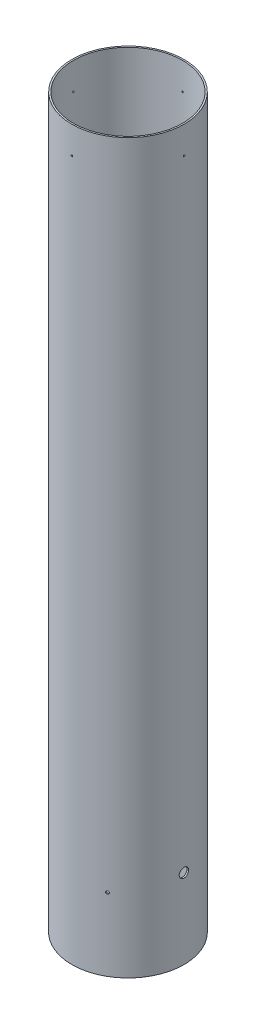
from build123d import *

# Parameters (mm, degrees)
SKETCH1_R           = 78.359
SKETCH1_R_2         = 76.1746
BOSS_EXTRUDE1_DEPTH = 1016
SKETCH2_R           = 1.0922
CUT_EXTRUDE1_DEPTH  = 1023.025570014
CIRPATTERN1_COUNT   = 4
CIRPATTERN2_COUNT   = 3


with BuildPart() as part:
    # Sketch1 → Boss-Extrude1 (new body)
    with BuildSketch(Plane(origin=(0, 0, 0), x_dir=(1, 0, 0), z_dir=(0, 1, 0))):
        Circle(SKETCH1_R)
        Circle(SKETCH1_R_2, mode=Mode.SUBTRACT)
    extrude(amount=BOSS_EXTRUDE1_DEPTH)

    # Sketch2 → Cut-Extrude1 (cut, through all)
    with BuildSketch(Plane(origin=(0, 0, 0), x_dir=(0, 0, -1), z_dir=(1, 0, 0))):
        with Locations((0, 977.9)):
            Circle(SKETCH2_R)
    cut_extrude1 = extrude(amount=-CUT_EXTRUDE1_DEPTH, mode=Mode.SUBTRACT)

    # CirPattern1: Cut-Extrude1 ×4 about axis
    cirpattern1_axis = Axis((0, 1016, 0), (0, 1, 0))
    for i in range(1, CIRPATTERN1_COUNT):
        add(cut_extrude1.rotate(cirpattern1_axis, i * 360 / CIRPATTERN1_COUNT), mode=Mode.SUBTRACT)

    # Sketch4 → 1/2 Clearance Hole1 (revolve, cut)
    with BuildSketch(Plane.ZX.offset(111.125)):
        Polygon((0, 0), (0, 92.834507437), (6.54812, 88.9), (6.54812, 0), align=None)
    revolve(axis=Axis((-6.35, 111.125, 0), (1, 0, 0)), mode=Mode.SUBTRACT)

    # Sketch6 → Ø4.0 (4) Diameter Hole1 (revolve, cut)
    with BuildSketch(Plane(origin=(0, 101.6, 0), x_dir=(0, 0, -1), z_dir=(0, 1, 0))):
        Polygon((0, 0), (0, 90.101721238), (2, 88.9), (2, 0), align=None)
    f_4_0_4_diameter_hole1 = revolve(axis=Axis((6.35, 101.6, 0), (-1, 0, 0)), mode=Mode.SUBTRACT)

    # CirPattern2: Ø4.0 (4) Diameter Hole1 ×3 about axis
    cirpattern2_axis = Axis((0, 0, 0), (0, 1, 0))
    for i in range(1, CIRPATTERN2_COUNT):
        add(f_4_0_4_diameter_hole1.rotate(cirpattern2_axis, i * 360 / CIRPATTERN2_COUNT), mode=Mode.SUBTRACT)


solid = part.part
